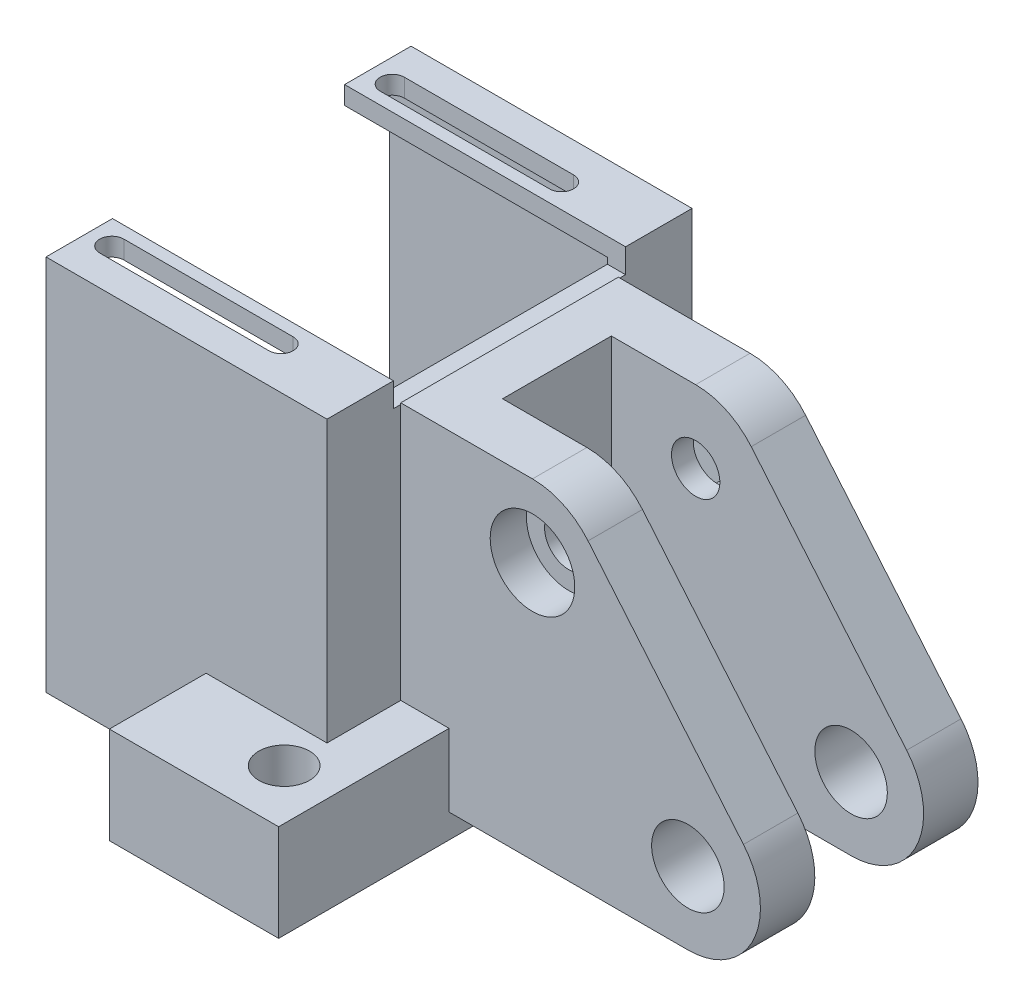
from build123d import *

# Parameters (mm, degrees)
EXTRUDE_1_DEPTH             = 9
SKETCH_2_W                  = 27.565905012
SKETCH_2_H                  = 27.320888862
CUT_EXTRUDE_1_DEPTH         = 4.5
CUT_EXTRUDE_2_DEPTH         = 2.7
SKETCH_5_R                  = 3
CUT_EXTRUDE_3_DEPTH         = 55.658762352
SKETCH_8_W                  = 23.244247806
SKETCH_8_H                  = 18
EXTRUDE_2_DEPTH             = 1.879111138
SKETCH_9_W                  = 23.244247806
SKETCH_9_H                  = 18
EXTRUDE_3_DEPTH             = 2
SKETCH_10_W                 = 23.244247806
SKETCH_10_H                 = 31.2
EXTRUDE_4_DEPTH             = 6.1
SKETCH_11_W                 = 23.244247806
SKETCH_11_H                 = 31.2
EXTRUDE_5_DEPTH             = 6.1
SHELL_START                 = -13.6
SHELL_2_OUTLINE_W           = 21.744247806
SHELL_2_OUTLINE_H           = 28.2
SHELL_2_DEPTH               = 27.2
SHELL_START_2               = -7.5
SHELL_2_2_OUTLINE_W         = 3.923676383
SHELL_2_2_OUTLINE_H         = 24.320888862
SHELL_2_2_DEPTH             = 15
SHELL_2_3_DEPTH             = 1.5
SHELL_START_3               = 6
SHELL_2_4_DEPTH             = 1.5
CUT_EXTRUDE_4_DEPTH         = 59.399058212
CUT_EXTRUDE_START           = -2
SKETCH_13_W                 = 23.244247806
SKETCH_13_H                 = 19.2
CUT_EXTRUDE_5_DEPTH         = 2
SKETCH_15_W                 = 10
SKETCH_15_H                 = 8
EXTRUDE_6_DEPTH             = 8
EXTRUDE_7_REACH             = 59.279
SKETCH_19_W                 = 4
SKETCH_19_H                 = 8
EXTRUDE_7_DIRECTION_2_REACH = 59.279
SKETCH_17_R                 = 2.1
CUT_EXTRUDE_6_DEPTH         = 61.959412727
SKETCH_20_W                 = 21.744247806
SKETCH_20_H                 = 28.2
EXTRUDE_8_DEPTH             = 0.3
SKETCH_21_W                 = 21.744247806
SKETCH_21_H                 = 28.2
EXTRUDE_9_DEPTH             = 0.3
CUT_EXTRUDE_7_REACH         = 62.959
SKETCH_22_W                 = 6.791501739
SKETCH_22_H                 = 18


# Read off the part's stored shape, not the designer's step: 抽壳2
with BuildPart() as part:
    # 草图1 → 凸台-拉伸1 (new, symmetric)
    with BuildSketch(Plane.XY):
        with BuildLine():
            Line((-8.259485535, 19.17761452), (4.596266659, 3.856725658))
            ThreePointArc((4.596266659, 3.856725658), (5.437846722, -2.53570957), (0, -6))
            Line((0, -6), (-47, -6))
            Line((-47, -6), (-47, 21.320888862))
            Line((-47, 21.320888862), (-12.855752194, 21.320888862))
            ThreePointArc((-12.855752194, 21.320888862), (-10.320042623, 20.758735585), (-8.259485535, 19.17761452))
        make_face()
    extrude(amount=EXTRUDE_1_DEPTH, both=True)

    # 草图2 → 切除-拉伸1 (cut, symmetric)
    with BuildSketch(Plane.XY):
        with Locations((-6.049123305, 7.660444431)):
            Rectangle(SKETCH_2_W, SKETCH_2_H)
    extrude(amount=CUT_EXTRUDE_1_DEPTH, both=True, mode=Mode.SUBTRACT)

    # 草图3 → 切除-旋转1 (revolve, cut)
    with BuildSketch(Plane(origin=(0, 0, 0), x_dir=(-0.642787609686538, 0.7660444431189792, 0), z_dir=(0.7660444431189791, 0.6427876096865379, 0)), mode=Mode.PRIVATE) as cut_revolve_1_sk:
        Polygon((19.999690983, -9), (17.499690983, -9), (17.499690983, -6.3), (17.999690983, -6.3), (17.999690983, 6), (16.499690983, 6), (16.499690983, 9), (19.999690983, 9), align=None)
    revolve(cut_revolve_1_sk.sketch.rotate(Axis((-12.855553561, 15.320652142, -10), (0, 0, 1)), 230), axis=Axis((-12.855553561, 15.320652142, -10), (0, 0, 1)), mode=Mode.SUBTRACT)

    # 草图4 → 切除-拉伸2 (cut)
    with BuildSketch(Plane(origin=(0, 0, -9), x_dir=(-1, 0, 0), z_dir=(0, 0, -1))):
        Polygon((11.76974521, 18.304668488), (9.728415424, 15.872322699), (10.814223775, 12.888306353), (13.941361912, 12.336635795), (15.982691699, 14.768981584), (14.896883348, 17.752997931), align=None)
    extrude(amount=-CUT_EXTRUDE_2_DEPTH, mode=Mode.SUBTRACT)

    # 草图5 → 切除-拉伸3 (cut, through all)
    with BuildSketch(Plane.XY.offset(9)):
        Circle(SKETCH_5_R)
    extrude(amount=-CUT_EXTRUDE_3_DEPTH, mode=Mode.SUBTRACT)

    # 草图8 → 凸台-拉伸2 (add)
    with BuildSketch(Plane(origin=(0, 21.320888862, 0), x_dir=(1, 0, 0), z_dir=(0, 1, 0))):
        with Locations((-35.377876097, 0)):
            Rectangle(SKETCH_8_W, SKETCH_8_H)
    extrude(amount=EXTRUDE_2_DEPTH)

    # 草图9 → 凸台-拉伸3 (add)
    with BuildSketch(Plane.XZ.offset(6)):
        with Locations((-35.377876097, 0)):
            Rectangle(SKETCH_9_W, SKETCH_9_H)
    extrude(amount=EXTRUDE_3_DEPTH)

    # 草图10 → 凸台-拉伸4 (add)
    with BuildSketch(Plane.XY.offset(9)):
        with Locations((-35.377876097, 7.6)):
            Rectangle(SKETCH_10_W, SKETCH_10_H)
    extrude(amount=EXTRUDE_4_DEPTH)

    # 草图11 → 凸台-拉伸5 (add)
    with BuildSketch(Plane(origin=(0, 0, -9), x_dir=(-1, 0, 0), z_dir=(0, 0, -1))):
        with Locations((35.377876097, 7.6)):
            Rectangle(SKETCH_11_W, SKETCH_11_H)
    extrude(amount=EXTRUDE_5_DEPTH)

    # 抽壳2 outline → 抽壳2 (cut)
    with BuildSketch(Plane.XY.offset(SHELL_START)):
        with Locations((-36.127876097, 7.6)):
            Rectangle(SHELL_2_OUTLINE_W, SHELL_2_OUTLINE_H)
    extrude(amount=SHELL_2_DEPTH, mode=Mode.SUBTRACT)

    # Shell 2 2 outline → Shell 2 2 (cut)
    with BuildSketch(Plane.XY.offset(SHELL_START_2)):
        with Locations((-23.293914003, 7.660444431)):
            Rectangle(SHELL_2_2_OUTLINE_W, SHELL_2_2_OUTLINE_H)
    extrude(amount=SHELL_2_2_DEPTH, mode=Mode.SUBTRACT)

    # Shell 2 3 outline → Shell 2 3 (cut)
    with BuildSketch(Plane.XY.offset(SHELL_START_2)):
        with BuildLine():
            Line((-9.700771165, 11.561572286), (-14.533621013, 10.708990515))
            Line((-14.533621013, 10.708990515), (-17.68840341, 14.46807037))
            Line((-17.68840341, 14.46807037), (-16.010335958, 19.079731997))
            Line((-16.010335958, 19.079731997), (-12.136777385, 19.763081477))
            ThreePointArc((-12.136777385, 19.763081477), (-12.495104697, 19.806413735), (-12.855752194, 19.820888862))
            Line((-12.855752194, 19.820888862), (-21.332075811, 19.820888862))
            Line((-21.332075811, 19.820888862), (-21.332075811, -4.5))
            Line((-21.332075811, -4.5), (0, -4.5))
            ThreePointArc((0, -4.5), (-4.078385042, 1.901782178), (3.447199994, 2.892544244))
            Line((3.447199994, 2.892544244), (-9.4085522, 18.213433106))
            ThreePointArc((-9.4085522, 18.213433106), (-9.939002288, 18.747632212), (-10.551084785, 19.18592549))
            Line((-10.551084785, 19.18592549), (-8.022703713, 16.173233913))
            Line((-8.022703713, 16.173233913), (-9.700771165, 11.561572286))
        make_face()
    extrude(amount=SHELL_2_3_DEPTH, mode=Mode.SUBTRACT)

    # Shell 2 4 outline → Shell 2 4 (cut)
    with BuildSketch(Plane.XY.offset(SHELL_START_3)):
        with BuildLine():
            Line((3.447199994, 2.892544244), (-8.007430451, 16.543641228))
            ThreePointArc((-8.007430451, 16.543641228), (-14.968890991, 10.789227983), (-15.034514198, 19.820888862))
            Line((-15.034514198, 19.820888862), (-21.332075811, 19.820888862))
            Line((-21.332075811, 19.820888862), (-21.332075811, -4.5))
            Line((-21.332075811, -4.5), (0, -4.5))
            ThreePointArc((0, -4.5), (-4.078385042, 1.901782178), (3.447199994, 2.892544244))
        make_face()
    extrude(amount=SHELL_2_4_DEPTH, mode=Mode.SUBTRACT)

    # 草图12 → 切除-拉伸4 (cut, through all)
    with BuildSketch(Plane.XZ.offset(8)):
        with BuildLine():
            Line((-45.055752194, 12.6), (-31.055752194, 12.6))
            ThreePointArc((-31.055752194, 12.6), (-30.055752194, 11.6), (-31.055752194, 10.6))
            Line((-31.055752194, 10.6), (-45.055752194, 10.6))
            ThreePointArc((-45.055752194, 10.6), (-46.055752194, 11.6), (-45.055752194, 12.6))
        make_face()
        with BuildLine():
            Line((-45.055752194, -10.6), (-31.055752194, -10.6))
            ThreePointArc((-31.055752194, -10.6), (-30.055752194, -11.6), (-31.055752194, -12.6))
            Line((-31.055752194, -12.6), (-45.055752194, -12.6))
            ThreePointArc((-45.055752194, -12.6), (-46.055752194, -11.6), (-45.055752194, -10.6))
        make_face()
    extrude(amount=-CUT_EXTRUDE_4_DEPTH, mode=Mode.SUBTRACT)

    # 草图13 → 切除-拉伸5 (cut)
    with BuildSketch(Plane(origin=(0, 23.2, 0), x_dir=(1, 0, 0), z_dir=(0, 1, 0)).offset(CUT_EXTRUDE_START)):
        with Locations((-35.377876097, 0)):
            Rectangle(SKETCH_13_W, SKETCH_13_H)
    extrude(amount=CUT_EXTRUDE_5_DEPTH, mode=Mode.SUBTRACT)

    # 草图15 → 凸台-拉伸6 (add)
    with BuildSketch(Plane.XY.offset(15.1)):
        with Locations((-28.755752194, -4)):
            Rectangle(SKETCH_15_W, SKETCH_15_H)
    extrude_6 = extrude(amount=EXTRUDE_6_DEPTH)

    # 镜向1: 凸台-拉伸6 across plane
    add(extrude_6.mirror(Plane.XY))

    # 凸台-拉伸7: up to this face of the body (flat: up to its plane)
    extrude_7_end = Plane(part.part.faces().sort_by_distance((-28.755752194, -4, 23.1))[0])
    # 草图19 → 凸台-拉伸7 (add, up to the picked face)
    with BuildSketch(Plane.XY, mode=Mode.PRIVATE) as extrude_7_sk1:
        with Locations((-21.755752194, -4)):
            Rectangle(SKETCH_19_W, SKETCH_19_H)
    extrude_7_tool1 = split(extrude(extrude_7_sk1.sketch, amount=EXTRUDE_7_REACH, mode=Mode.PRIVATE), bisect_by=extrude_7_end, keep=Keep.BOTH, mode=Mode.PRIVATE)
    add(extrude_7_tool1.solids().sort_by(Axis((-21.755752, -4, 0), (0, 0, 1)))[0])

    # 凸台-拉伸7 direction 2: up to this face of the body (flat: up to its plane)
    extrude_7_direction_2_end = Plane(part.part.faces().sort_by_distance((-28.755752194, -4, -23.1))[0])
    # 草图19 → 凸台-拉伸7 direction 2 (add, up to the picked face)
    with BuildSketch(Plane.XY, mode=Mode.PRIVATE) as extrude_7_direction_2_sk1:
        with Locations((-21.755752194, -4)):
            Rectangle(SKETCH_19_W, SKETCH_19_H)
    extrude_7_direction_2_tool1 = split(extrude(extrude_7_direction_2_sk1.sketch, amount=-EXTRUDE_7_DIRECTION_2_REACH, mode=Mode.PRIVATE), bisect_by=extrude_7_direction_2_end, keep=Keep.BOTH, mode=Mode.PRIVATE)
    add(extrude_7_direction_2_tool1.solids().sort_by(Axis((-21.755752, -4, 0), (0, 0, -1)))[0])

    # 草图17 → 切除-拉伸6 (cut, through all)
    with BuildSketch(Plane.XZ.offset(8)):
        with Locations(Location((-23.897040888, 18.5, 0), (0, 0, 270))):
            Circle(SKETCH_17_R)
        with Locations(Location((-23.897040888, -18.5, 0), (0, 0, 270))):
            Circle(SKETCH_17_R)
    extrude(amount=-CUT_EXTRUDE_6_DEPTH, mode=Mode.SUBTRACT)

    # 草图20 → 凸台-拉伸8 (add)
    with BuildSketch(Plane.XY.offset(-13.6)):
        with Locations((-36.127876097, 7.6)):
            Rectangle(SKETCH_20_W, SKETCH_20_H)
    extrude(amount=EXTRUDE_8_DEPTH)

    # 草图21 → 凸台-拉伸9 (add)
    with BuildSketch(Plane(origin=(0, 0, 13.6), x_dir=(-1, 0, 0), z_dir=(0, 0, -1))):
        with Locations((36.127876097, 7.6)):
            Rectangle(SKETCH_21_W, SKETCH_21_H)
    extrude(amount=EXTRUDE_9_DEPTH)

    # 草图22 → 切除-拉伸7 (cut, up to next)
    with BuildSketch(Plane.XZ.offset(8), mode=Mode.PRIVATE) as cut_extrude_7_sk1:
        with Locations((-43.604249131, 0)):
            Rectangle(SKETCH_22_W, SKETCH_22_H)
    cut_extrude_7_tool1 = extrude(cut_extrude_7_sk1.sketch, amount=-CUT_EXTRUDE_7_REACH, mode=Mode.PRIVATE) & part.part
    add(cut_extrude_7_tool1.solids().sort_by_distance((-43.604249, -8, 0))[0], mode=Mode.SUBTRACT)


solid = part.part
